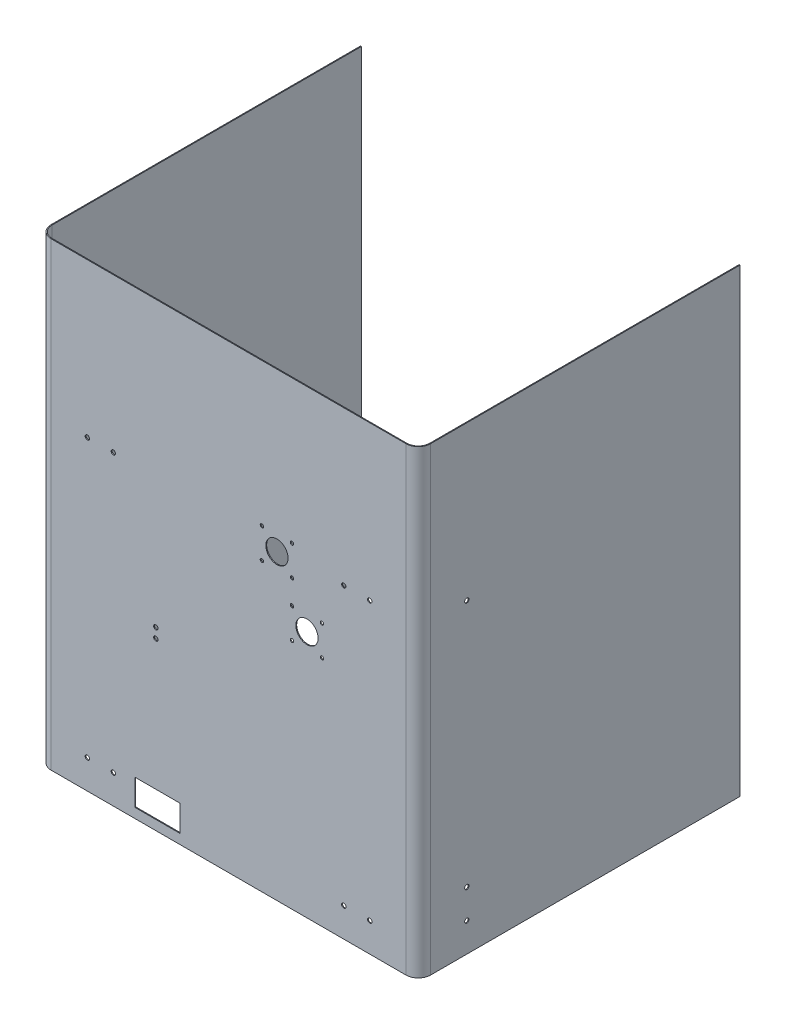
from build123d import *

# Parameters (mm, degrees)
BASE_FLANGE2_DEPTH         = 475
SKETCH13_R                 = 2.25
CUT_EXTRUDE4_DEPTH         = 700.483927325
SKETCH14_R                 = 11.5
SKETCH14_R_2               = 1.75
STEPPER_MOTOR_CUTOUT_DEPTH = 0.889
SKETCH15_R                 = 2.25
CUT_EXTRUDE6_DEPTH         = 0.889
SKETCH16_W                 = 46.8
SKETCH16_H                 = 27
CUT_EXTRUDE7_DEPTH         = 0.889
M4_CLEARANCE_HOLE1_D       = 4.5


# Sheet-metal steps are written as plain solids
with BuildPart() as part:
    # Sketch1 → Base-Flange2 (new body)
    with BuildSketch(Plane(origin=(0, 0, 0), x_dir=(1, 0, 0), z_dir=(0, 1, 0))):
        with BuildLine():
            Line((195.849919955, 332), (195.849919955, 12.7))
            ThreePointArc((195.849919955, 12.7), (192.130176076, 3.719743879), (183.149919955, 0))
            Line((183.149919955, 0), (-183.149919955, 0))
            ThreePointArc((-183.149919955, 0), (-192.130176076, 3.719743879), (-195.849919955, 12.7))
            Line((-195.849919955, 12.7), (-195.849919955, 332))
            Line((-195.849919955, 332), (-194.960919955, 332))
            Line((-194.960919955, 332), (-194.960919955, 12.7))
            ThreePointArc((-194.960919955, 12.7), (-191.501558148, 4.348361807), (-183.149919955, 0.889))
            Line((-183.149919955, 0.889), (183.149919955, 0.889))
            ThreePointArc((183.149919955, 0.889), (191.501558148, 4.348361807), (194.960919955, 12.7))
            Line((194.960919955, 12.7), (194.960919955, 332))
            Line((194.960919955, 332), (195.849919955, 332))
        make_face()
    extrude(amount=BASE_FLANGE2_DEPTH)

    # Sketch13 → Cut-Extrude4 (cut, through all)
    with BuildSketch(Plane(origin=(195.849919955, 0, 0), x_dir=(0, 0, -1), z_dir=(1, 0, 0))):
        with Locations((50.096107, 60)):
            Circle(SKETCH13_R)
        with Locations((50.096107, 316.132840032)):
            Circle(SKETCH13_R)
        with Locations((50.096107, 30)):
            Circle(SKETCH13_R)
    extrude(amount=-CUT_EXTRUDE4_DEPTH, mode=Mode.SUBTRACT)

    # Sketch14 → Stepper motor cutout (cut)
    with BuildSketch(Plane.XY):
        with Locations((49.936500045, 311.73292)):
            Circle(SKETCH14_R)
        with Locations((34.436500045, 296.23292)):
            Circle(SKETCH14_R_2)
        with Locations((65.436500045, 296.23292)):
            Circle(SKETCH14_R_2)
        with Locations((34.436500045, 327.23292)):
            Circle(SKETCH14_R_2)
        with Locations((65.436500045, 327.23292)):
            Circle(SKETCH14_R_2)
        with Locations((80.936500045, 255.73292)):
            Circle(SKETCH14_R)
        with Locations((65.436500045, 240.23292)):
            Circle(SKETCH14_R_2)
        with Locations((96.436500045, 240.23292)):
            Circle(SKETCH14_R_2)
        with Locations((65.436500045, 271.23292)):
            Circle(SKETCH14_R_2)
        with Locations((96.436500045, 271.23292)):
            Circle(SKETCH14_R_2)
    extrude(amount=-STEPPER_MOTOR_CUTOUT_DEPTH, mode=Mode.SUBTRACT)

    # Sketch15 → Cut-Extrude6 (cut)
    with BuildSketch(Plane.XY):
        with Locations((-145.753812955, 316.132839976)):
            Circle(SKETCH15_R)
        with Locations((-118.946026845, 316.132839976)):
            Circle(SKETCH15_R)
        with Locations((118.946026845, 316.132839976)):
            Circle(SKETCH15_R)
        with Locations((145.753812955, 316.132839976)):
            Circle(SKETCH15_R)
        with Locations((145.753812955, 30)):
            Circle(SKETCH15_R)
        with Locations((118.946026845, 30)):
            Circle(SKETCH15_R)
        with Locations((-118.946026845, 30)):
            Circle(SKETCH15_R)
        with Locations((-145.753812955, 30)):
            Circle(SKETCH15_R)
    extrude(amount=-CUT_EXTRUDE6_DEPTH, mode=Mode.SUBTRACT)

    # Sketch16 → Cut-Extrude7 (cut)
    with BuildSketch(Plane.XY):
        with Locations((-73.4, 23.5)):
            Rectangle(SKETCH16_W, SKETCH16_H)
    extrude(amount=-CUT_EXTRUDE7_DEPTH, mode=Mode.SUBTRACT)

    # M4 Clearance Hole1 (through all)
    with Locations(Plane.XY):
        with Locations((-75.063499955, 181.73292), (-75.063499955, 171.73292)):
            Hole(M4_CLEARANCE_HOLE1_D / 2)


solid = part.part
